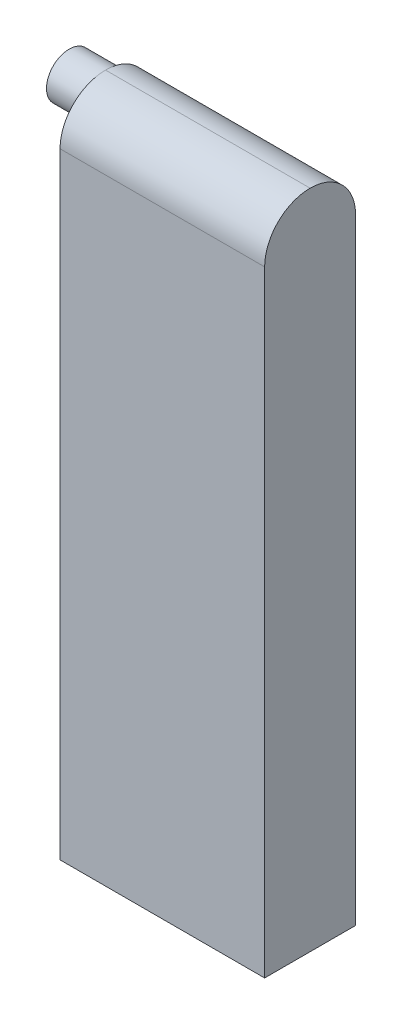
from build123d import *

# Parameters (mm, degrees)
CROQUIS1_W              = 45
CROQUIS1_H              = 145.5
SALIENTE_EXTRUIR1_DEPTH = 20
REDONDEO1_R             = 10
CROQUIS2_R              = 5
SALIENTE_EXTRUIR2_DEPTH = 8


with BuildPart() as part:
    # Croquis1 → Saliente-Extruir1 (new body)
    with BuildSketch(Plane.XY):
        with Locations((-22.5, 72.75)):
            Rectangle(CROQUIS1_W, CROQUIS1_H)
    extrude(amount=SALIENTE_EXTRUIR1_DEPTH)

    # Redondeo1
    redondeo1_edges = [part.edges().sort_by_distance(p)[0] for p in [
        (-22.5, 145.5, 0),
        (-22.5, 145.5, 20),
    ]]
    fillet(redondeo1_edges, radius=REDONDEO1_R - 0.0001)  # a hair under: the kernel refuses the full size

    # Croquis2 → Saliente-Extruir2 (add)
    with BuildSketch(Plane.ZY.offset(45)):
        with Locations(Location((10, 140.5, 0), (0, 0, 89.99948753))):
            Circle(CROQUIS2_R)
    extrude(amount=SALIENTE_EXTRUIR2_DEPTH)


solid = part.part
